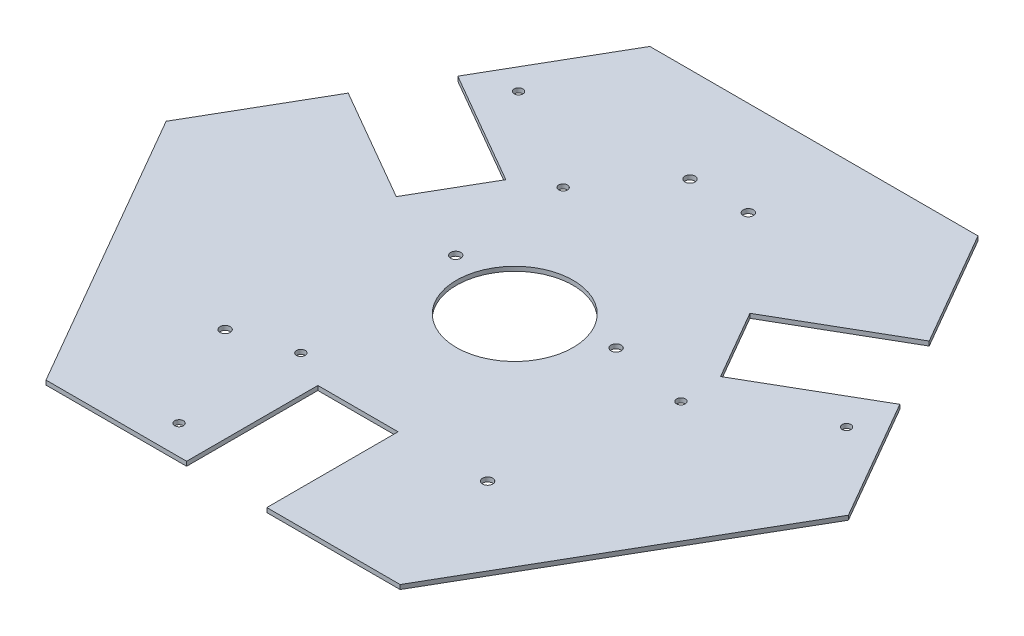
from build123d import *

# Parameters (mm, degrees)
SKETCH1_R           = 3
SKETCH1_R_2         = 3.5
SKETCH1_R_3         = 40
BOSS_EXTRUDE1_DEPTH = 3


with BuildPart() as part:
    # Sketch1 → Boss-Extrude1 (new body)
    with BuildSketch(Plane(origin=(0, 0, 0), x_dir=(1, 0, 0), z_dir=(0, 1, 0))):
        Polygon((158.205080757, 125.980762114), (112.5, 205.144284149), (-112.5, 205.144284149), (-160.705080757, 121.650635095), (-82.762794416, 76.650635095), (-95.262794416, 55), (-110.262794416, 29.019237886), (-188.205080757, 74.019237886), (-233.910161514, -5.144284149), (-121.410161514, -200), (-25, -200), (-25, -110), (0, -110), (30, -110), (30, -200), (121.410161514, -200), (233.910161514, -5.144284149), (185.705080757, 78.349364905), (107.762794416, 33.349364905), (80.262794416, 80.980762114), align=None)
        with Locations(Location((-50.14, -180, 0), (0, 0, 270))):
            Circle(SKETCH1_R, mode=Mode.SUBTRACT)
        with Locations(Location((-90, -108.599272381, 0), (0, 0, 270))):
            Circle(SKETCH1_R_2, mode=Mode.SUBTRACT)
        with Locations(Location((-50.14, -96.51, 0), (0, 0, 270))):
            Circle(SKETCH1_R, mode=Mode.SUBTRACT)
        with Locations(Location((90, -108.599272381, 0), (0, 0, 270))):
            Circle(SKETCH1_R_2, mode=Mode.SUBTRACT)
        with Locations(Location((0, 0, 0), (0, 0, 270))):
            Circle(SKETCH1_R_3, mode=Mode.SUBTRACT)
        with Locations(Location((-55, 14.522505884, 0), (0, 0, 270))):
            Circle(SKETCH1_R_2, mode=Mode.SUBTRACT)
        with Locations(Location((-58.510111719, 91.677513746, 0), (0, 0, 270))):
            Circle(SKETCH1_R, mode=Mode.SUBTRACT)
        with Locations(Location((-130.814572681, 133.422513746, 0), (0, 0, 270))):
            Circle(SKETCH1_R, mode=Mode.SUBTRACT)
        with Locations(Location((-20, 140.144284149, 0), (0, 0, 270))):
            Circle(SKETCH1_R_2, mode=Mode.SUBTRACT)
        with Locations(Location((55, 14.522505884, 0), (0, 0, 270))):
            Circle(SKETCH1_R_2, mode=Mode.SUBTRACT)
        with Locations(Location((108.953220611, 5.007486254, 0), (0, 0, 270))):
            Circle(SKETCH1_R, mode=Mode.SUBTRACT)
        with Locations(Location((180.954572681, 46.577486254, 0), (0, 0, 270))):
            Circle(SKETCH1_R, mode=Mode.SUBTRACT)
        with Locations(Location((20, 140.144284149, 0), (0, 0, 270))):
            Circle(SKETCH1_R_2, mode=Mode.SUBTRACT)
    extrude(amount=BOSS_EXTRUDE1_DEPTH)


solid = part.part
